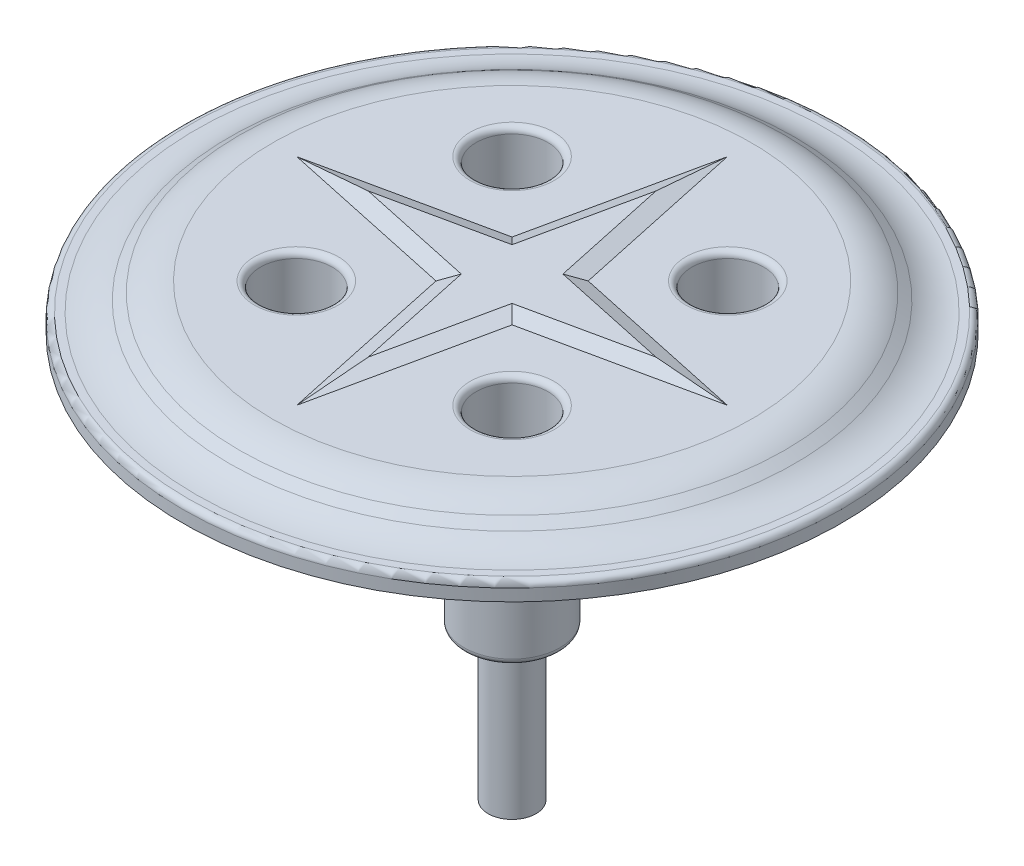
from build123d import *

# Parameters (mm, degrees)
FILLET1_R                = 10
FILLET2_R                = 1
SKETCH2_R                = 8
BOSS_EXTRUDE1_DEPTH      = 27
CUT_EXTRUDE1_START       = -5
SKETCH2_3_R              = 6
CUT_EXTRUDE1_DEPTH       = 30
SKETCH2_4_R              = 4
CUT_EXTRUDE2_DEPTH       = 83.334682917
FILLET3_R                = 1
CIRPATTERN1_COUNT        = 4
FILLET3_OF_CIRPATTERN1_R = 1
SKETCH3_R                = 5
BOSS_EXTRUDE2_DEPTH      = 40
BOSS_EXTRUDE3_START      = 40
SKETCH3_3_R              = 4
BOSS_EXTRUDE3_DEPTH      = 30
BOUNDARY1_DEPTH          = 1
BOUNDARY1_DRAFT          = 68.2026845
FILLET4_R                = 1
FILLET5_R                = 1


# Read off the part's stored shape, not the designer's step: Boundary1
with BuildPart() as part:
    # Sketch1 → Revolve1 (revolve)
    with BuildSketch(Plane.YZ, mode=Mode.PRIVATE) as revolve1_sk:
        Polygon((39.5, 42.99), (39.5, 0), (44.5, 0), (44.5, 43), (40, 49.71), (40, 55), (37, 55), (37, 42.99), align=None)
    revolve(revolve1_sk.sketch.rotate(Axis((0, -79.648884709, 0), (0, 1, 0)), 180), axis=Axis((0, -79.648884709, 0), (0, 1, 0)))

    # Fillet1
    fillet1_edges = [part.edges().sort_by_distance(p)[0] for p in [
        (0, 44.5, 43),
        (0, 40, 49.71),
    ]]
    fillet(fillet1_edges, radius=FILLET1_R)

    # Fillet2
    fillet2_edges = [part.edges().sort_by_distance(p)[0] for p in [
        (0, 40, 55),
    ]]
    fillet(fillet2_edges, radius=FILLET2_R)

    # Sketch2 → Boss-Extrude1 (add)
    with BuildSketch(Plane.XZ.offset(-39.5)):
        with Locations(Location((-18, 18, 0), (0, 0, 90))):
            Circle(SKETCH2_R)
    boss_extrude1 = extrude(amount=BOSS_EXTRUDE1_DEPTH)

    # Sketch2<3> → Cut-Extrude1 (cut)
    with BuildSketch(Plane.XZ.offset(-39.5).offset(CUT_EXTRUDE1_START)):
        with Locations(Location((-18, 18, 0), (0, 0, 90))):
            Circle(SKETCH2_3_R)
    cut_extrude1 = extrude(amount=CUT_EXTRUDE1_DEPTH, mode=Mode.SUBTRACT)

    # Sketch2<4> → Cut-Extrude2 (cut, symmetric)
    with BuildSketch(Plane.XZ.offset(-39.5)):
        with Locations(Location((-18, 18, 0), (0, 0, 270))):
            Circle(SKETCH2_4_R)
    cut_extrude2 = extrude(amount=CUT_EXTRUDE2_DEPTH, both=True, mode=Mode.SUBTRACT)

    # Fillet3
    fillet3_edges = [part.edges().sort_by_distance(p)[0] for p in [
        (-18, 12.5, 10),
        (-18, 14.5, 12),
        (-18, 44.5, 12),
    ]]
    fillet(fillet3_edges, radius=FILLET3_R)

    # CirPattern1: Boss-Extrude1, Cut-Extrude1, Cut-Extrude2 ×4 about axis
    cirpattern1_axis = Axis((0, 0, 0), (0, 1, 0))
    add([boss_extrude1.rotate(cirpattern1_axis, i * 360 / CIRPATTERN1_COUNT) for i in range(1, CIRPATTERN1_COUNT)])
    add([cut_extrude1.rotate(cirpattern1_axis, i * 360 / CIRPATTERN1_COUNT) for i in range(1, CIRPATTERN1_COUNT)], mode=Mode.SUBTRACT)
    add([cut_extrude2.rotate(cirpattern1_axis, i * 360 / CIRPATTERN1_COUNT) for i in range(1, CIRPATTERN1_COUNT)], mode=Mode.SUBTRACT)

    # Fillet3 of CirPattern1
    fillet3_of_cirpattern1_edges = [part.edges().sort_by_distance(p)[0] for p in [
        (10, 12.5, 18),
        (12, 14.5, 18),
        (12, 44.5, 18),
        (18, 12.5, -10),
        (18, 14.5, -12),
        (18, 44.5, -12),
        (-10, 12.5, -18),
        (-12, 14.5, -18),
        (-12, 44.5, -18),
    ]]
    fillet(fillet3_of_cirpattern1_edges, radius=FILLET3_OF_CIRPATTERN1_R)

    # Sketch3 → Boss-Extrude2 (add)
    with BuildSketch(Plane.XZ.offset(-39.5)):
        with Locations(Location((0, 0, 0), (0, 0, 90))):
            Circle(SKETCH3_R)
    extrude(amount=BOSS_EXTRUDE2_DEPTH)

    # Sketch3<3> → Boss-Extrude3 (add)
    with BuildSketch(Plane.XZ.offset(-39.5).offset(BOSS_EXTRUDE3_START)):
        with Locations(Location((0, 0, 0), (0, 0, 270))):
            Circle(SKETCH3_3_R)
    extrude(amount=BOSS_EXTRUDE3_DEPTH)


with BuildPart() as boundary1_tool:
    # Boundary1 outline → Boundary1 (with draft: the straight prism first)
    with BuildSketch(Plane(origin=(0, 45.5, 0), x_dir=(1, 0, 0), z_dir=(0, 1, 0))):
        Polygon((24, 0), (4.242640687, 4.242640687), (0, 24), (-4.242640687, 4.242640687), (-24, 0), (-4.242640687, -4.242640687), (0, -24), (4.242640687, -4.242640687), align=None)
    extrude(amount=-BOUNDARY1_DEPTH)
    # Boundary1: the draft: its side faces are tilted about the plane it starts from
    boundary1_sides = [boundary1_tool.faces().sort_by_distance(p)[0] for p in [
        (14.121320343, 45, -2.121320343),
        (2.121320343, 45, -14.121320343),
        (-2.121320343, 45, -14.121320343),
        (-14.121320343, 45, -2.121320343),
        (-14.121320343, 45, 2.121320343),
        (-2.121320343, 45, 14.121320343),
        (2.121320343, 45, 14.121320343),
        (14.121320343, 45, 2.121320343),
    ]]
    draft(boundary1_sides, Plane(origin=(0, 45.5, 0), x_dir=(1, 0, 0), z_dir=(0, 1, 0)), BOUNDARY1_DRAFT)


with BuildPart() as part_1:
    add(part.part)

    # Boundary1: add boundary1_tool
    add(boundary1_tool.part)

    # Fillet4
    fillet4_edges = [part_1.edges().sort_by_distance(p)[0] for p in [
        (0, 39.5, 42.99),
        (0, 37, 42.99),
    ]]
    fillet(fillet4_edges, radius=FILLET4_R)

    # Fillet5
    fillet5_edges = [part_1.edges().sort_by_distance(p)[0] for p in [
        (-18, 39.5, 10),
        (10, 39.5, 18),
        (18, 39.5, -10),
        (-10, 39.5, -18),
    ]]
    fillet(fillet5_edges, radius=FILLET5_R)


solid = part_1.part
